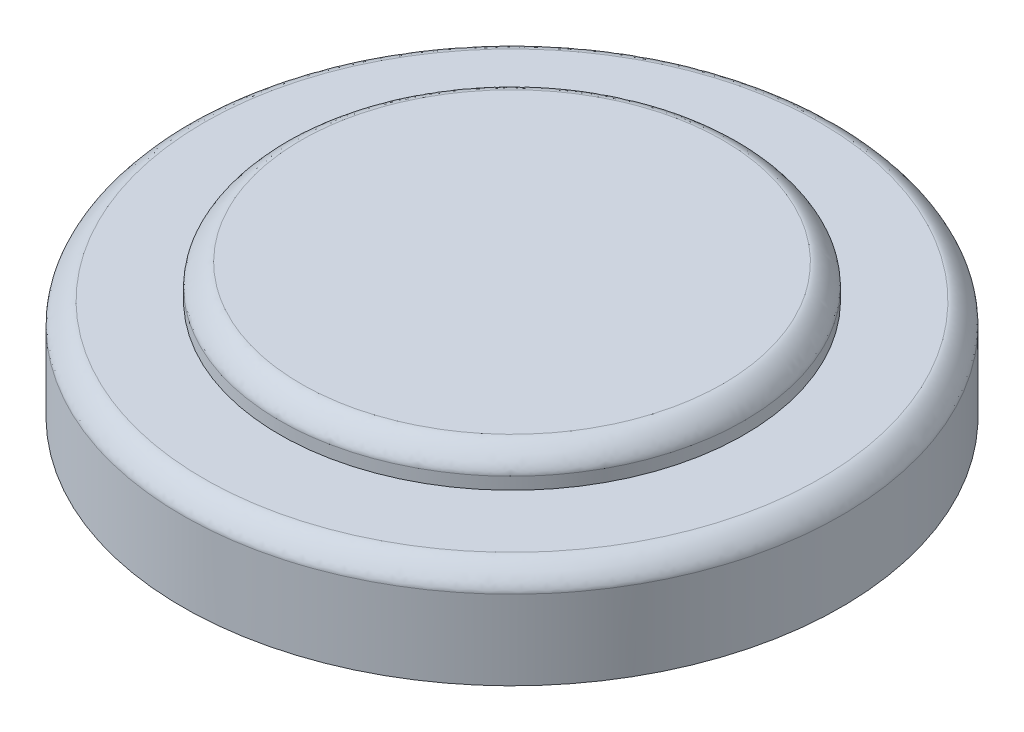
from build123d import *

# Parameters (mm, degrees)
FILLET1_SIZE = 2.54


with BuildPart() as part:
    # Sketch1 → Revolve1 (revolve)
    with BuildSketch(Plane.XY, mode=Mode.PRIVATE) as revolve1_sk:
        Polygon((25.703882473, 0), (39.351675245, 0), (39.351675245, 12.013848808), (27.737641542, 12.013848808), (27.737641542, 16.005835686), (0, 16.005835686), (0, 12.013848808), (25.703882473, 12.013848808), align=None)
    revolve(revolve1_sk.sketch.rotate(Axis((0, 0, 0), (0, 1, 0)), 90), axis=Axis((0, 0, 0), (0, 1, 0)))

    # Fillet1
    # a fillet whose section is not a circle: 2.54 mm, written as the material it adds along each edge
    with BuildSketch(Plane(origin=(0, 12.013848808, 0), x_dir=(0, 0, -1), z_dir=(1, 0, 0))) as fillet1_piece_1:
        with BuildLine():
            Bezier((25.703882473 - FILLET1_SIZE, 0), (25.703882473, 0), (25.703882473, -FILLET1_SIZE), weights=[1, 0.365051062, 1])
            Line((25.703882473, -FILLET1_SIZE), (25.703882473, 0))
            Line((25.703882473, 0), (25.703882473 - FILLET1_SIZE, 0))
        make_face()
    revolve(axis=Axis((0, 12.013848808, 0), (0, 1, 0)))
    # a fillet whose section is not a circle: 2.54 mm, written as the material it takes off along each edge
    with BuildSketch(Plane(origin=(0, 16.005835686, 0), x_dir=(0, 0, -1), z_dir=(1, 0, 0))) as fillet1_2_piece_1:
        with BuildLine():
            Bezier((27.737641542, -FILLET1_SIZE), (27.737641542, 0), (27.737641542 - FILLET1_SIZE, 0), weights=[1, 0.365051062, 1])
            Line((27.737641542 - FILLET1_SIZE, 0), (27.737641542, 0))
            Line((27.737641542, 0), (27.737641542, -FILLET1_SIZE))
        make_face()
    revolve(axis=Axis((0, 16.005835686, 0), (0, 1, 0)), mode=Mode.SUBTRACT)
    with BuildSketch(Plane(origin=(0, 12.013848808, 0), x_dir=(0, 0, -1), z_dir=(1, 0, 0))) as fillet1_2_piece_2:
        with BuildLine():
            Bezier((39.351675245, -FILLET1_SIZE), (39.351675245, 0), (39.351675245 - FILLET1_SIZE, 0), weights=[1, 0.365051062, 1])
            Line((39.351675245 - FILLET1_SIZE, 0), (39.351675245, 0))
            Line((39.351675245, 0), (39.351675245, -FILLET1_SIZE))
        make_face()
    revolve(axis=Axis((0, 12.013848808, 0), (0, 1, 0)), mode=Mode.SUBTRACT)


solid = part.part
